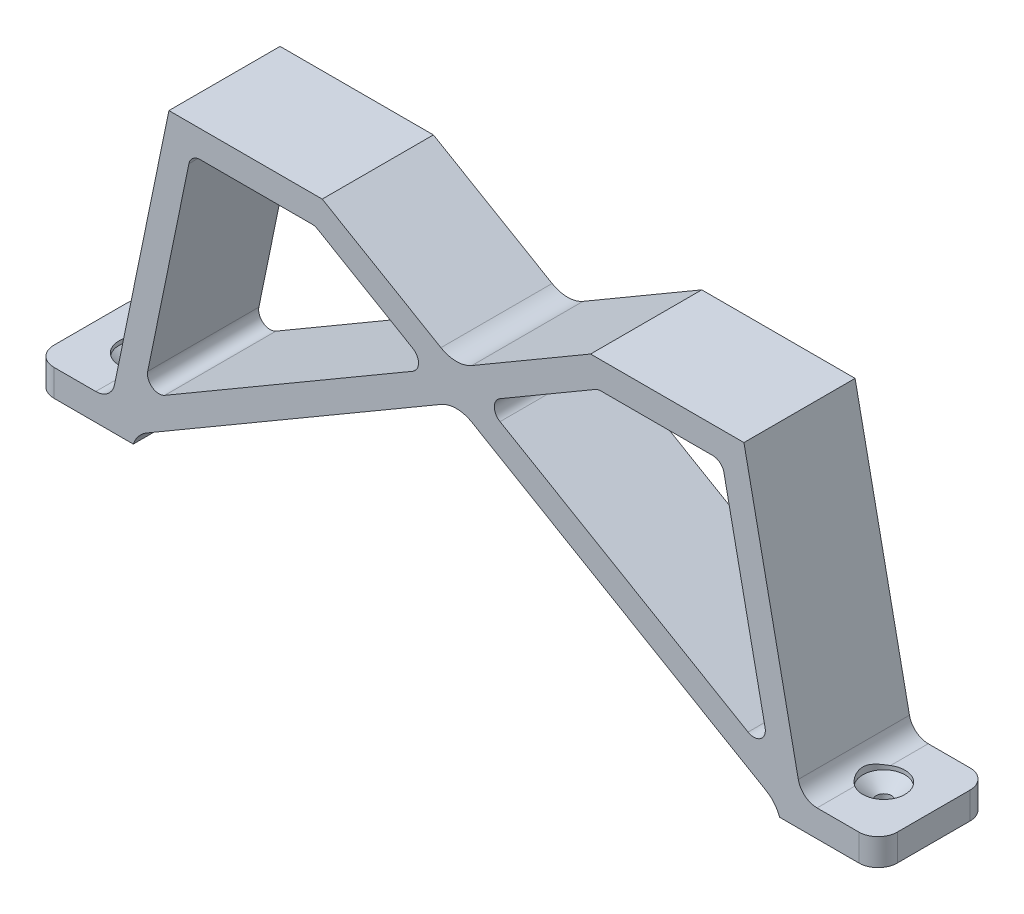
from build123d import *

# Parameters (mm, degrees)
EXTRU_MINCE1_DEPTH      = 14.5
CONG_1_R                = 5
CONG_2_R                = 5
ESQUISSE4_R             = 2
ENL_V_MAT_EXTRU_1_DEPTH = 3
ESQUISSE5_R             = 5.5
ENL_V_MAT_EXTRU_2_DEPTH = 136.052767465
CHANFREIN1_SIZE2        = 3.5
CHANFREIN1_SIZE         = 2.936848709
CONG_3_R                = 8
CONG_4_R                = 3


# Some blends are built 0.0001 mm under size
with BuildPart() as part:
    # Esquisse1 → Extru.-Mince1 (new, symmetric)
    with BuildSketch(Plane.XY):
        Polygon((-110, 0), (-90, 0), (-75, 73), (-35, 73), (90, 0), (86.469896568, -6.044697657), (-36.894311748, 66), (-69.292107606, 66), (-84.292107606, -7), (-110, -7), align=None)
    extrude(amount=EXTRU_MINCE1_DEPTH, both=True)

    # Congé1
    cong_1_edges = [part.edges().sort_by_distance(p)[0] for p in [
        (-110, -3.5, 14.5),
        (-110, -3.5, -14.5),
    ]]
    fillet(cong_1_edges, radius=CONG_1_R)

    # Congé2
    cong_2_edges = [part.edges().sort_by_distance(p)[0] for p in [
        (-90, 0, 0),
    ]]
    fillet(cong_2_edges, radius=CONG_2_R)

    # Esquisse4 → Enlèv. mat.-Extru.1 (cut)
    with BuildSketch(Plane.XZ.offset(7)):
        with Locations((-97, 0)):
            Circle(ESQUISSE4_R)
    extrude(amount=-ENL_V_MAT_EXTRU_1_DEPTH, mode=Mode.SUBTRACT)

    # Esquisse5 → Enlèv. mat.-Extru.2 (cut, through all)
    with BuildSketch(Plane.XZ.offset(4)):
        with Locations((-97, 0)):
            Circle(ESQUISSE5_R)
    extrude(amount=-ENL_V_MAT_EXTRU_2_DEPTH, mode=Mode.SUBTRACT)

    # Chanfrein1
    chanfrein1_edges = [part.edges().sort_by_distance(p)[0] for p in [
        (-102.5, -4, 0),
    ]]
    chanfrein1_side = [part.faces().sort_by_distance(p)[0] for p in [
        (-102.5, -3.941263026, 0),
    ]]
    chamfer(chanfrein1_edges, length=CHANFREIN1_SIZE - 0.0001, length2=CHANFREIN1_SIZE2 - 0.0001, reference=chanfrein1_side[0])  # a hair under: the kernel refuses the full size

    # Symétrie1: part across plane


with BuildPart() as part_1:
    add(part.part)
    add(part.part.mirror(Plane(origin=(0, 0, 0), x_dir=(0, 0, 1), z_dir=(1, 0, 0))))

    # Congé3
    # the kernel refuses this fillet: 8 mm, written as the material it adds along each edge
    with BuildSketch(Plane(origin=(0, 52.56, 14.5), x_dir=(-0.8635282366882334, 0.504300490225927, 0), z_dir=(0, 0, -1))) as cong_3_piece_1:
        with BuildLine():
            CenterArc((CONG_3_R * 0.584, CONG_3_R), CONG_3_R, 209.430143301, 60.569856699)
            Line((-CONG_3_R * 0.286955426172, CONG_3_R * 0.508637968884), (-CONG_3_R * 0.304374534695, CONG_3_R * 0.498810728262))
            Line((-CONG_3_R * 0.304374534695, CONG_3_R * 0.498810728262), (-CONG_3_R * 0.01168, -CONG_3_R * 0.02))
            Line((-CONG_3_R * 0.01168, -CONG_3_R * 0.02), (CONG_3_R * 0.584, -CONG_3_R * 0.02))
            Line((CONG_3_R * 0.584, -CONG_3_R * 0.02), (CONG_3_R * 0.584, 0))
        make_face()
    extrude(amount=29)
    with BuildSketch(Plane(origin=(0, 44.453721939, 14.5), x_dir=(-0.8635282366882323, -0.5043004902259292, 0), z_dir=(0, 0, -1))) as cong_3_piece_2:
        with BuildLine():
            CenterArc((CONG_3_R * 0.584, -CONG_3_R), CONG_3_R, 90, 60.569856699)
            Line((-CONG_3_R * 0.286955426172, -CONG_3_R * 0.508637968884), (-CONG_3_R * 0.304374534695, -CONG_3_R * 0.498810728262))
            Line((-CONG_3_R * 0.304374534695, -CONG_3_R * 0.498810728262), (-CONG_3_R * 0.01168, CONG_3_R * 0.02))
            Line((-CONG_3_R * 0.01168, CONG_3_R * 0.02), (CONG_3_R * 0.584, CONG_3_R * 0.02))
            Line((CONG_3_R * 0.584, CONG_3_R * 0.02), (CONG_3_R * 0.584, 0))
        make_face()
    extrude(amount=29)
    with BuildSketch(Plane(origin=(83.772073882, -4.469169208, -14.5), x_dir=(-0.8635282366882329, 0.504300490225928, 0), z_dir=(0, 0, 1))) as cong_3_piece_3:
        with BuildLine():
            CenterArc((3.477750225, 8), CONG_3_R, 229.429051082, 40.570948918)
            Line((-1.725363014, 1.923190589), (-1.829425279, 1.801654401))
            ThreePointArc((-1.829425279, 1.801654401), (-0.981778041, 0.854749538), (-0.119096533, -0.106845757))
            Line((-0.119096533, -0.106845757), (0, -0.16))
            Line((0, -0.16), (3.477750225, -0.16))
            Line((3.477750225, -0.16), (3.477750225, 0))
        make_face()
    extrude(amount=29)
    with BuildSketch(Plane(origin=(-83.772073882, -4.469169208, -14.5), x_dir=(-0.20127429834952004, -0.979534918634302, 0), z_dir=(0, 0, 1))) as cong_3_piece_4:
        with BuildLine():
            CenterArc((3.632433829, 7.930962811), CONG_3_R, 221.896414773, 40.570948918)
            Line((-2.322392841, 2.588674974), (-2.441489374, 2.481829217))
            Line((-2.441489374, 2.481829217), (-0.119096533, -0.106845757))
            Line((-0.119096533, -0.106845757), (0, -0.16))
            ThreePointArc((0, -0.16), (1.291853279, -0.16), (2.562732012, -0.158619256))
            Line((2.562732012, -0.158619256), (2.583706557, 0))
        make_face()
    extrude(amount=29)

    # Congé4
    cong_4_edges = [part_1.edges().sort_by_distance(p)[0] for p in [
        (-36.894311748, 66, 0),
        (-69.292107606, 66, 0),
        (6.940306559, 48.50686097, 0),
        (-6.940306559, 48.50686097, 0),
        (81.879263002, 4.742510407, 0),
        (-81.879263002, 4.742510407, 0),
        (69.292107606, 66, 0),
        (36.894311748, 66, 0),
    ]]
    fillet(cong_4_edges, radius=CONG_4_R)


solid = part_1.part
